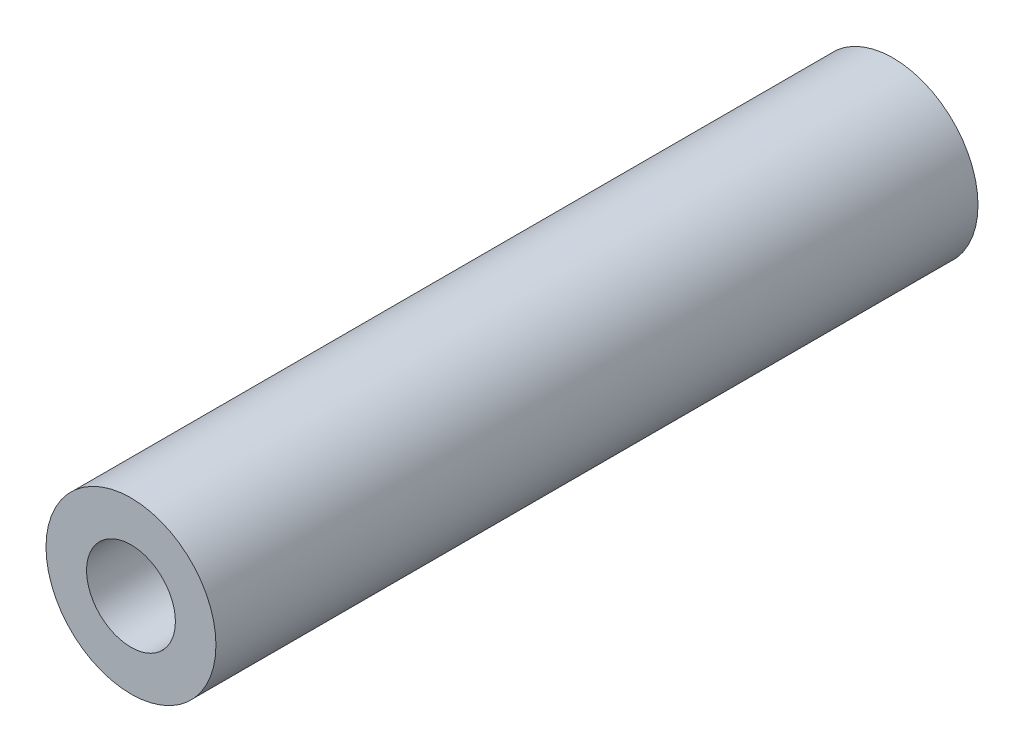
from build123d import *

# Parameters (mm, degrees)
SKETCH1_R           = 4.7625
SKETCH1_R_2         = 2.4892
BOSS_EXTRUDE1_DEPTH = 21.35505


with BuildPart() as part:
    # Sketch1 → Boss-Extrude1 (new, symmetric)
    with BuildSketch(Plane.XY):
        Circle(SKETCH1_R)
        Circle(SKETCH1_R_2, mode=Mode.SUBTRACT)
    extrude(amount=BOSS_EXTRUDE1_DEPTH, both=True)


solid = part.part
